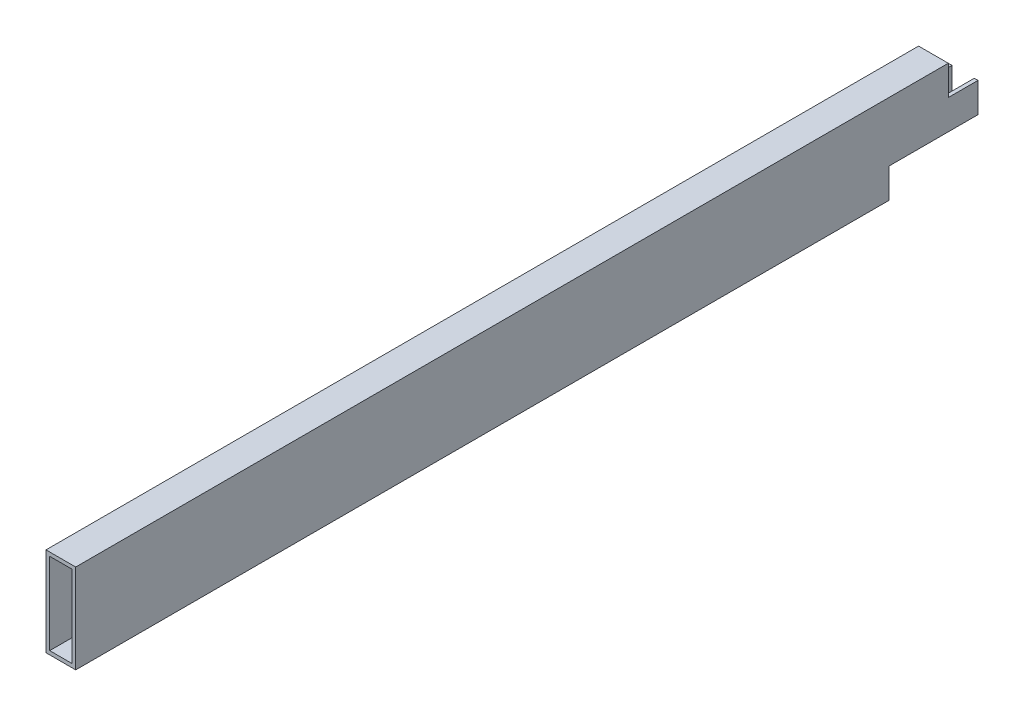
from build123d import *

# Parameters (mm, degrees)
SKETCH1_W           = 25.4
SKETCH1_H           = 76.2
BOSS_EXTRUDE1_DEPTH = 385.699
SHELL1_T            = -3.175
SKETCH2_W           = 76.2
SKETCH2_H           = 25.4
CUT_EXTRUDE1_DEPTH  = 389.407632007
SKETCH3_W           = 25.4
SKETCH3_H           = 25.4
CUT_EXTRUDE2_DEPTH  = 389.407632007


with BuildPart() as part:
    # Sketch1 → Boss-Extrude1 (new, symmetric)
    with BuildSketch(Plane.XY):
        Rectangle(SKETCH1_W, SKETCH1_H)
    extrude(amount=BOSS_EXTRUDE1_DEPTH, both=True)

    # Shell1
    shell1_openings = [part.faces().sort_by_distance(p)[0] for p in [
        (0, 0, -385.699),
        (0, 0, 385.699),
    ]]
    offset(amount=SHELL1_T, openings=shell1_openings, kind=Kind.INTERSECTION)

    # Sketch2 → Cut-Extrude1 (cut, through all)
    with BuildSketch(Plane(origin=(12.7, 0, 0), x_dir=(0, 0, -1), z_dir=(1, 0, 0))):
        with Locations((347.599, -25.4)):
            Rectangle(SKETCH2_W, SKETCH2_H)
    extrude(amount=-CUT_EXTRUDE1_DEPTH, mode=Mode.SUBTRACT)

    # Sketch3 → Cut-Extrude2 (cut, through all)
    with BuildSketch(Plane(origin=(12.7, 0, 0), x_dir=(0, 0, -1), z_dir=(1, 0, 0))):
        with Locations((372.999, 25.4)):
            Rectangle(SKETCH3_W, SKETCH3_H)
    extrude(amount=-CUT_EXTRUDE2_DEPTH, mode=Mode.SUBTRACT)


solid = part.part
